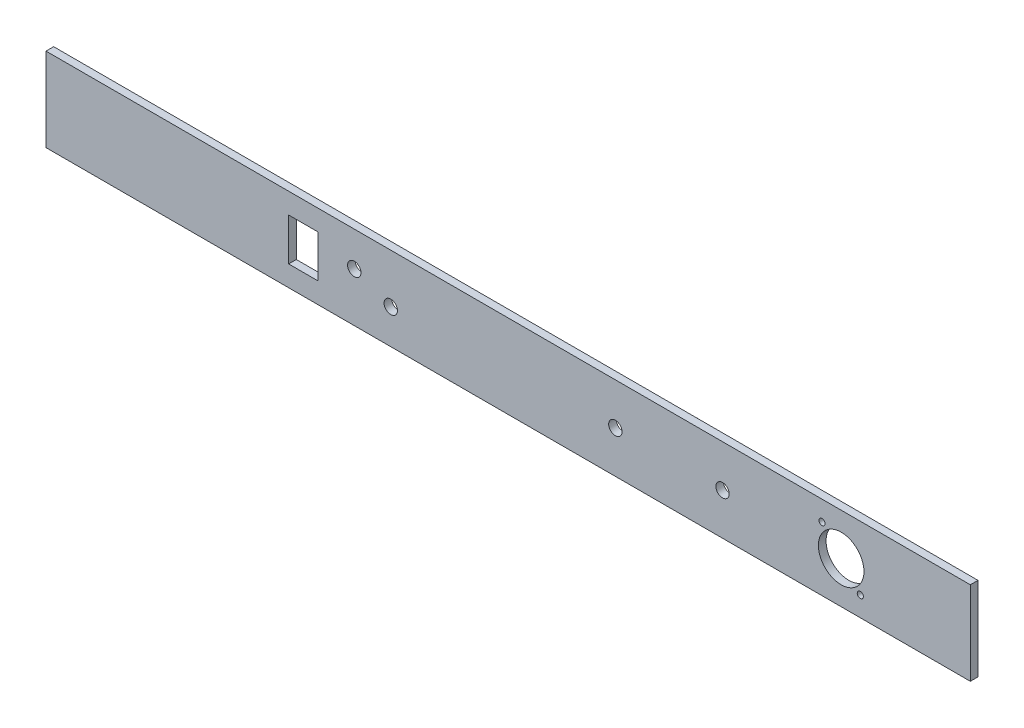
from build123d import *

# Parameters (mm, degrees)
SKETCH1_W           = 483
SKETCH1_H           = 43.7
BOSS_EXTRUDE1_DEPTH = 4
SKETCH2_R           = 3.5
SKETCH2_R_2         = 11.9
SKETCH2_R_3         = 1.6
SKETCH2_W           = 15.419852382
SKETCH2_H           = 22.139786355
CUT_EXTRUDE1_DEPTH  = 4


with BuildPart() as part:
    # Sketch1 → Boss-Extrude1 (new body)
    with BuildSketch(Plane.XY):
        Rectangle(SKETCH1_W, SKETCH1_H)
    extrude(amount=BOSS_EXTRUDE1_DEPTH)

    # Sketch2 → Cut-Extrude1 (cut)
    with BuildSketch(Plane.XY.offset(4)):
        with Locations((56.00741792, 0.046520021)):
            Circle(SKETCH2_R)
        with Locations((173.993165462, 0)):
            Circle(SKETCH2_R_2)
        with Locations((112.007386351, -0.086241539)):
            Circle(SKETCH2_R)
        with Locations((183.993165462, -11.5)):
            Circle(SKETCH2_R_3)
        with Locations((163.993165462, 11.5)):
            Circle(SKETCH2_R_3)
        with Locations((-80.408291792, 3.809863468)):
            Circle(SKETCH2_R)
        with Locations((-61.358471482, -3.810063592)):
            Circle(SKETCH2_R)
        with Locations((-106.998126785, 0.004549598)):
            Rectangle(SKETCH2_W, SKETCH2_H)
    extrude(amount=-CUT_EXTRUDE1_DEPTH, mode=Mode.SUBTRACT)


solid = part.part
